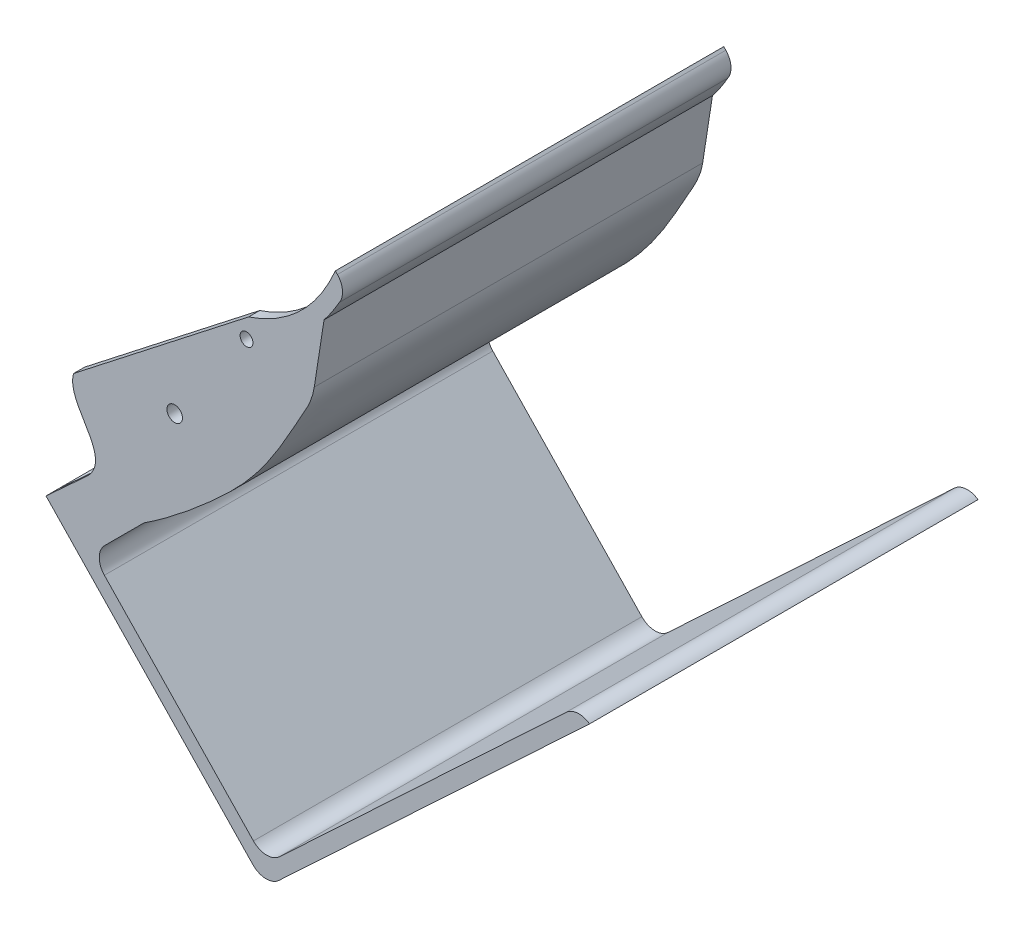
from build123d import *

# Parameters (mm, degrees)
SKETCH8_R                = 2.1
SKETCH8_R_2              = 1.74
BOSS_EXTRUDE5_DEPTH      = 3
BOSS_EXTRUDE6_DEPTH      = 3
BOSS_EXTRUDE6_DEPTH_BACK = 102
CUT_EXTRUDE6_DEPTH       = 102
CUT_EXTRUDE7_DEPTH       = 351.757992155
FILLET4_START            = -103
FILLET4_DEPTH            = 106.0000125
FILLET4_2_DEPTH          = 103
FILLET4_START_2          = -102
FILLET4_3_DEPTH          = 105


with BuildPart() as part:
    # Sketch8 → Boss-Extrude5 (new body)
    with BuildSketch(Plane.XY):
        with BuildLine():
            Line((194.848649274, 149.66882856), (147.499802828, 112.737422991))
            add(Edge.make_bspline(
                [(147.499802828, 112.737422991), (145.265647531, 104.835476757), (158.932413363, 97.556045407), (150.870592183, 90.287256683)],
                knots=[0, 0, 0, 0, 1, 1, 1, 1], degree=3))
            Line((150.870592183, 90.287256683), (140.051642672, 80.353100098))
            add(Edge.make_bspline(
                [(140.051642672, 80.353100098), (155.592742122, 83.448151063), (173.098788956, 95.918040541), (191.414470585, 112.977156665), (199.578997946, 124.491589325), (204.778131359, 134.171165561), (209.351664244, 141.990562819), (208.010100445, 153.27525953), (198.018173528, 148.56277144), (194.848649274, 149.66882856)],
                knots=[0, 0, 0, 0, 0.401406189, 0.551773829, 0.650466729, 0.768454277, 0.83589521, 0.892031584, 1, 1, 1, 1], degree=3))
        make_face()
        with Locations((174.835792074, 117.000151074)):
            Circle(SKETCH8_R, mode=Mode.SUBTRACT)
        with Locations((194.258704, 144.1418815)):
            Circle(SKETCH8_R_2, mode=Mode.SUBTRACT)
    extrude(amount=BOSS_EXTRUDE5_DEPTH)

    # Sketch18 → Boss-Extrude6 (add, two sides: drawn at the far end of the back side and taken through both)
    with BuildSketch(Plane.XY.offset(-BOSS_EXTRUDE6_DEPTH_BACK)):
        with BuildLine():
            Line((140.051642672, 80.353100098), (199.394938769, 18.42711696))
            Line((199.394938769, 18.42711696), (286.996969106, 100.450384619))
            Line((286.996969106, 100.450384619), (218.278514002, 172.159544237))
            add(Edge.make_bspline(
                [(194.848649274, 149.66882856), (210.911598583, 155.039307248), (218.278514002, 172.159544237)],
                knots=[0, 0, 0, 1, 1, 1], degree=2))
            add(Edge.make_bspline(
                [(140.051642672, 80.353100098), (155.592742122, 83.448151063), (173.098788956, 95.918040541), (191.414470585, 112.977156665), (199.578997946, 124.491589325), (204.778131359, 134.171165561), (209.351664244, 141.990562819), (208.010100445, 153.27525953), (198.018173528, 148.56277144), (194.848649274, 149.66882856)],
                knots=[0, 0, 0, 0, 0.401406189, 0.551773829, 0.650466729, 0.768454277, 0.83589521, 0.892031584, 1, 1, 1, 1], degree=3))
        make_face()
    extrude(amount=BOSS_EXTRUDE6_DEPTH + BOSS_EXTRUDE6_DEPTH_BACK)

    # Sketch28 → Cut-Extrude6 (cut)
    with BuildSketch(Plane(origin=(0, 0, -102), x_dir=(-1, 0, 0), z_dir=(0, 0, -1))):
        with BuildLine():
            Line((-208.618011268, 142.695698437), (-211.42914656, 160.85099201))
            add(Edge.make_bspline(
                [(-211.42914656, 160.85099201), (-204.811588501, 152.999832831), (-194.848649266, 149.668828558)],
                knots=[0, 0, 0, 1, 1, 1], degree=2))
            add(Edge.make_bspline(
                [(-194.848649266, 149.668828558), (-198.018173528, 148.56277144), (-208.010100445, 153.27525953), (-208.973304937, 145.173169587), (-208.63144162, 142.782828241), (-208.618011268, 142.695698437)],
                knots=[0, 0, 0, 0, 0.107968416, 0.16410479, 0.166243216, 0.166243216, 0.166243216, 0.166243216], degree=3))
        make_face()
    extrude(amount=-CUT_EXTRUDE6_DEPTH, mode=Mode.SUBTRACT)

    # Sketch29 → Cut-Extrude7 (cut, through all)
    with BuildSketch(Plane(origin=(0, 0, -102), x_dir=(-1, 0, 0), z_dir=(0, 0, -1))):
        with BuildLine():
            Line((-219.332027088, 165.278919845), (-221.693040793, 168.596413398))
            Line((-221.693040793, 168.596413398), (-284.229221249, 103.338587978))
            Line((-284.229221249, 103.338587978), (-281.309153571, 100.604479056))
            Line((-281.309153571, 100.604479056), (-199.54725859, 24.049429241))
            Line((-199.54725859, 24.049429241), (-152.445384828, 73.201229566))
            Line((-152.445384828, 73.201229566), (-166.56681579, 87.314829228))
            add(Edge.make_bspline(
                [(-166.56681579, 87.314829228), (-167.247375692, 87.754878287), (-167.923513322, 88.203571781), (-169.408228588, 89.212727742), (-170.215496626, 89.77742737), (-171.813710515, 90.924683403), (-172.605151804, 91.507550134), (-174.958933573, 93.280907842), (-176.500751491, 94.49613279), (-179.542120366, 96.977523194), (-181.041657541, 98.243705262), (-184.010446881, 100.812569153), (-185.48012911, 102.114732661), (-188.36646995, 104.782964203), (-189.785315925, 106.151551275), (-192.521802781, 108.956131315), (-193.84163234, 110.393993249), (-197.617679355, 114.842362145), (-199.885576111, 117.991237054), (-204.064324609, 124.551324395), (-205.96551608, 127.969600494), (-208.351957694, 132.235160217), (-208.830232235, 133.087828175), (-209.795652517, 134.789170357), (-210.277597021, 135.640186131), (-211.148682062, 137.383997182), (-211.538483698, 138.276494838), (-212.172269158, 140.127136004), (-212.416807154, 141.08503003), (-212.570906768, 142.083638665)],
                knots=[0.224160015, 0.224160015, 0.224160015, 0.224160015, 0.25, 0.25, 0.28125, 0.28125, 0.3125, 0.3125, 0.375, 0.375, 0.4375, 0.4375, 0.5, 0.5, 0.5625, 0.5625, 0.625, 0.625, 0.75, 0.75, 0.875, 0.875, 0.90625, 0.90625, 0.9375, 0.9375, 0.96875, 0.96875, 1, 1, 1, 1], degree=3))
            Line((-212.570906768, 142.083638665), (-215.214954835, 159.159823598))
            add(Edge.make_bspline(
                [(-215.214954835, 159.159823598), (-216.753654874, 161.087602867), (-218.117640246, 163.132934646), (-219.332027088, 165.278919845)],
                knots=[8.2e-08, 8.2e-08, 8.2e-08, 8.2e-08, 1, 1, 1, 1], degree=3))
        make_face()
    extrude(amount=-CUT_EXTRUDE7_DEPTH, mode=Mode.SUBTRACT)

    # Fillet4: read off the stored shape, not the designer's step
    # Fillet4 outline → Fillet4 (cut)
    with BuildSketch(Plane.XY.offset(FILLET4_START)):
        with BuildLine():
            ThreePointArc((280.686945589, 100.021895163), (283.765601821, 101.360567021), (286.996969106, 100.450384619))
            Line((286.996969106, 100.450384619), (284.229221249, 103.338587978))
            Line((284.229221249, 103.338587978), (280.686945589, 100.021895163))
        make_face()
        with BuildLine():
            ThreePointArc((203.002745436, 21.805167569), (199.449928109, 20.456841246), (195.97532653, 21.995554573))
            Line((195.97532653, 21.995554573), (199.394938769, 18.42711696))
            Line((199.394938769, 18.42711696), (203.002745436, 21.805167569))
        make_face()
        with BuildLine():
            Line((221.693040793, 168.596413398), (218.830479101, 171.583556997))
            ThreePointArc((218.830479101, 171.583556997), (220.20472039, 168.520612757), (219.332027088, 165.278919845))
            Line((219.332027088, 165.278919845), (221.693040793, 168.596413398))
        make_face()
    extrude(amount=FILLET4_DEPTH, mode=Mode.SUBTRACT)

    # Fillet4 2 outline → Fillet4 2 (cut)
    with BuildSketch(Plane.XY.offset(FILLET4_START)):
        with BuildLine():
            Line((211.42914656, 160.85099201), (211.221601366, 159.510592657))
            ThreePointArc((211.221601366, 159.510592657), (211.57833699, 160.741370081), (212.236188394, 161.841054082))
            add(Edge.make_bspline(
                [(212.236188394, 161.841054082), (211.839086372, 161.337350073), (211.42914656, 160.85099201)],
                knots=[0.341334138, 0.341334138, 0.341334138, 0.379756542, 0.379756542, 0.379756542], degree=2))
        make_face()
    extrude(amount=FILLET4_2_DEPTH, mode=Mode.SUBTRACT)

    # Fillet4 3 outline → Fillet4 3 (add)
    with BuildSketch(Plane.XY.offset(FILLET4_START_2)):
        with BuildLine():
            Line((152.445384828, 73.201229566), (155.832885267, 69.666301295))
            ThreePointArc((155.832885267, 69.666301295), (154.443188104, 73.179681156), (155.908344132, 76.662268423))
            Line((155.908344132, 76.662268423), (152.445384828, 73.201229566))
        make_face()
        with BuildLine():
            Line((199.54725859, 24.049429241), (203.155065257, 27.427479849))
            ThreePointArc((203.155065257, 27.427479849), (199.60224793, 26.079153527), (196.127646351, 27.617866853))
            Line((196.127646351, 27.617866853), (199.54725859, 24.049429241))
        make_face()
    extrude(amount=FILLET4_3_DEPTH)


solid = part.part
